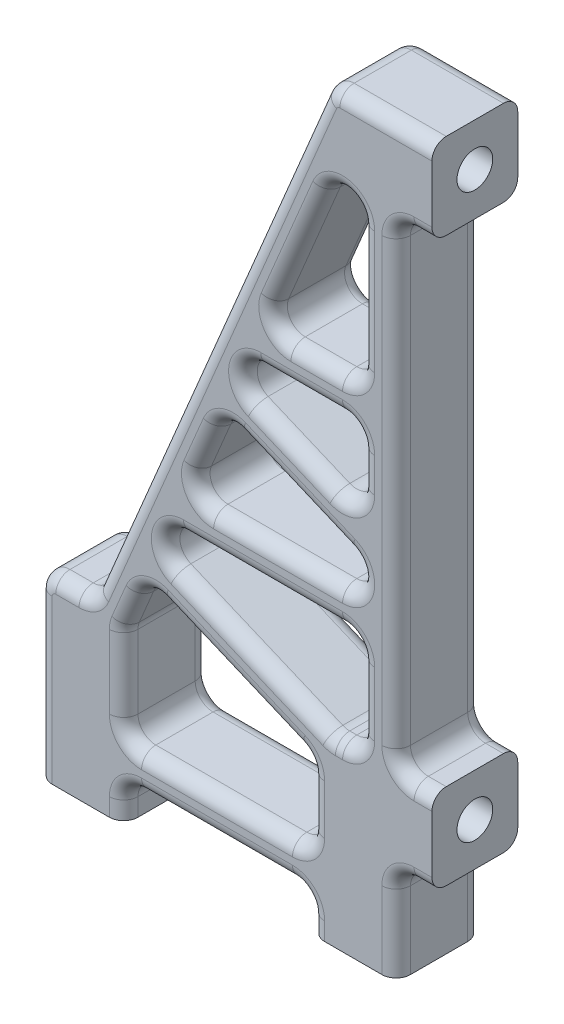
from build123d import *

# Parameters (mm, degrees)
EXTRUDE_1_DEPTH     = 6
EXTRUDE_2_DEPTH     = 6
FILLET_1_R          = 1.25
SKETCH_3_R          = 1.25
CUT_EXTRUDE_1_DEPTH = 7
SKETCH_4_R          = 1.25
CUT_EXTRUDE_2_DEPTH = 7
FILLET_7_R          = 1


with BuildPart() as part:
    # Эскиз1 → Бобышка-Вытянуть1 (new body)
    with BuildSketch(Plane.XY):
        with BuildLine():
            Line((27.55, 46), (27.55, 52))
            Line((27.55, 52), (21.113666967, 52))
            ThreePointArc((21.113666967, 52), (20.422226359, 51.79135003), (19.96161625, 51.235055816))
            Line((19.96161625, 51.235055816), (4.029534487, 13.394944184))
            ThreePointArc((4.029534487, 13.394944184), (3.568924378, 12.83864997), (2.877483769, 12.63))
            Line((2.877483769, 12.63), (1.25, 12.63))
            ThreePointArc((1.25, 12.63), (0.366116524, 12.263883476), (0, 11.38))
            Line((0, 11.38), (0, 0))
            Line((0, 0), (6, 0))
            Line((6, 0), (6, 1.25))
            ThreePointArc((6, 1.25), (6.366116524, 2.133883476), (7.25, 2.5))
            Line((7.25, 2.5), (17.8, 2.5))
            ThreePointArc((17.8, 2.5), (18.683883476, 2.133883476), (19.05, 1.25))
            Line((19.05, 1.25), (19.05, 0))
            Line((19.05, 0), (25.05, 0))
            Line((25.05, 0), (25.05, 5.38))
            ThreePointArc((25.05, 5.38), (25.416116524, 6.263883476), (26.3, 6.63))
            Line((26.3, 6.63), (27.55, 6.63))
            Line((27.55, 6.63), (27.55, 12.63))
            Line((27.55, 12.63), (26.3, 12.63))
            ThreePointArc((26.3, 12.63), (25.416116524, 12.996116524), (25.05, 13.88))
            Line((25.05, 13.88), (25.05, 44.75))
            ThreePointArc((25.05, 44.75), (25.416116524, 45.633883476), (26.3, 46))
            Line((26.3, 46), (27.55, 46))
        make_face()
        with BuildLine():
            Line((19.05, 6.25), (19.05, 11.38))
            ThreePointArc((19.05, 11.38), (19.416116524, 12.263883476), (20.3, 12.63))
            Line((20.3, 12.63), (21.3, 12.63))
            ThreePointArc((21.3, 12.63), (22.183883476, 12.996116524), (22.55, 13.88))
            Line((22.55, 13.88), (22.55, 44.75))
            ThreePointArc((22.55, 44.75), (21.547423325, 45.975268011), (20.147949283, 45.235055816))
            Line((20.147949283, 45.235055816), (6.097949283, 11.865055816))
            ThreePointArc((6.097949283, 11.865055816), (6.024731989, 11.627423325), (6, 11.38))
            Line((6, 11.38), (6, 6.25))
            ThreePointArc((6, 6.25), (6.366116524, 5.366116524), (7.25, 5))
            Line((7.25, 5), (17.8, 5))
            ThreePointArc((17.8, 5), (18.683883476, 5.366116524), (19.05, 6.25))
        make_face(mode=Mode.SUBTRACT)
    extrude(amount=EXTRUDE_1_DEPTH)

    # Эскиз2 → Бобышка-Вытянуть2 (add)
    with BuildSketch(Plane.XY):
        with BuildLine():
            Line((9.033112254, 18.836329009), (7.577944882, 15.380177038))
            Line((7.577944882, 15.380177038), (19.05, 10.55001898))
            Line((19.05, 10.55001898), (19.05, 11.38))
            ThreePointArc((19.05, 11.38), (19.416116524, 12.263883476), (20.3, 12.63))
            Line((20.3, 12.63), (20.552417555, 12.63))
            Line((20.552417555, 12.63), (9.700107232, 17.199222656))
            ThreePointArc((9.700107232, 17.199222656), (9.027553953, 17.879636665), (9.033112254, 18.836329009))
        make_face()
        with BuildLine():
            Line((15.809843094, 34.931667665), (14.435181166, 31.666723286))
            ThreePointArc((14.435181166, 31.666723286), (14.895791269, 32.223017637), (15.587231966, 32.431667665))
            Line((15.587231966, 32.431667665), (22.55, 32.431667665))
            Line((22.55, 32.431667665), (22.55, 34.931667665))
            Line((22.55, 34.931667665), (15.809843094, 34.931667665))
        make_face()
        with BuildLine():
            ThreePointArc((21.785055816, 24.503324091), (22.34135003, 24.042713982), (22.55, 23.351273374))
            Line((22.55, 23.351273374), (22.55, 26.893808584))
            Line((22.55, 26.893808584), (15.10217615, 30.029616948))
            ThreePointArc((15.10217615, 30.029616948), (14.429622874, 30.710030949), (14.435181166, 31.666723286))
            Line((14.435181166, 31.666723286), (12.9800138, 28.210571329))
            Line((12.9800138, 28.210571329), (21.785055816, 24.503324091))
        make_face()
        with BuildLine():
            Line((10.407774176, 22.101273374), (9.033112254, 18.836329009))
            ThreePointArc((9.033112254, 18.836329009), (9.493722358, 19.39262335), (10.185163048, 19.601273374))
            Line((10.185163048, 19.601273374), (22.55, 19.601273374))
            Line((22.55, 19.601273374), (22.55, 23.351273374))
            ThreePointArc((22.55, 23.351273374), (22.183883476, 22.467389897), (21.3, 22.101273374))
            Line((21.3, 22.101273374), (10.407774176, 22.101273374))
        make_face()
    extrude(amount=EXTRUDE_2_DEPTH)

    # Скругление1
    fillet_1_edges = [part.edges().sort_by_distance(p)[0] for p in [
        (19.05, 10.55001898, 3),
        (20.552417555, 12.63, 3),
        (7.577944882, 15.380177038, 3),
        (22.55, 19.601273374, 3),
        (10.407774176, 22.101273374, 3),
        (12.9800138, 28.210571329, 3),
        (22.55, 26.893808584, 3),
        (22.55, 32.431667665, 3),
        (15.809843094, 34.931667665, 3),
        (22.55, 34.931667665, 3),
    ]]
    fillet(fillet_1_edges, radius=FILLET_1_R)

    # Эскиз3 → Вырез-Вытянуть1 (cut)
    with BuildSketch(Plane(origin=(27.55, 0, 0), x_dir=(0, 0, -1), z_dir=(1, 0, 0))):
        with Locations((-3, 49)):
            Circle(SKETCH_3_R)
        with Locations((-3, 9.63)):
            Circle(SKETCH_3_R)
    extrude(amount=-CUT_EXTRUDE_1_DEPTH, mode=Mode.SUBTRACT)

    # Эскиз4 → Вырез-Вытянуть2 (cut)
    with BuildSketch(Plane.XZ):
        with Locations((3, 3)):
            Circle(SKETCH_4_R)
        with Locations((22.05, 3)):
            Circle(SKETCH_4_R)
    extrude(amount=-CUT_EXTRUDE_2_DEPTH, mode=Mode.SUBTRACT)

    # Скругление7
    fillet_7_edges = [part.edges().sort_by_distance(p)[0] for p in [
        (21.547423325, 45.975268011, 6),
        (14.361963955, 31.42909099, 6),
        (18.443615983, 32.431667665, 6),
        (17.958560167, 26.114419802, 6),
        (22.525268011, 23.103850049, 6),
        (15.009943263, 14.96358597, 6),
        (8.959895037, 18.598696699, 6),
        (15.742581524, 19.601273374, 6),
        (6, 0.625, 6),
        (24.331833484, 52, 6),
        (20.422226359, 51.79135003, 6),
        (0, 5.69, 6),
        (19.496208131, 34.931667665, 6),
        (17.958560167, 28.826973992, 6),
        (16.795173672, 22.101273374, 6),
        (25.05, 29.315, 6),
        (25.05, 2.69, 6),
        (12.525, 2.5, 6),
        (11.995575368, 32.315, 6),
        (16.651066233, 35.490227057, 6),
        (18.344157414, 40.950889648, 6),
        (22.55, 40.465833832, 6),
        (22.183883476, 35.297784189, 6),
        (22.183883476, 32.065551141, 6),
        (22.55, 29.979024709, 6),
        (21.991440608, 27.735031723, 6),
        (11.248997315, 22.659832765, 6),
        (11.816627306, 25.447424901, 6),
        (13.175372084, 27.731073927, 6),
        (16.651066233, 35.490227057, 0),
        (18.344157414, 40.950889648, 0),
        (21.547423325, 45.975268011, 0),
        (22.55, 40.465833832, 0),
        (22.183883476, 35.297784189, 0),
        (14.361963955, 31.42909099, 0),
        (18.443615983, 32.431667665, 0),
        (22.183883476, 32.065551141, 0),
        (22.55, 29.979024709, 0),
        (21.991440608, 27.735031723, 0),
        (11.248997315, 22.659832765, 0),
        (11.816627306, 25.447424901, 0),
        (13.175372084, 27.731073927, 0),
        (17.958560167, 26.114419802, 0),
        (22.525268011, 23.103850049, 0),
        (20.557411786, 12.654731989, 0),
        (21.052417555, 12.63, 0),
        (22.183883476, 12.996116524, 0),
        (22.55, 16.115636687, 0),
        (22.183883476, 19.23515685, 0),
        (15.742581524, 19.601273374, 0),
        (8.959895037, 18.598696699, 0),
        (6.366116524, 5.366116524, 0),
        (6, 8.815, 0),
        (6.024731989, 11.627423325, 0),
        (6.595419175, 13.046591068, 0),
        (7.773303166, 14.900679636, 0),
        (13.507525708, 12.883604949, 0),
        (18.84135003, 10.411478568, 0),
        (19.05, 7.98501898, 0),
        (18.683883476, 5.366116524, 0),
        (24.331833484, 52, 0),
        (20.422226359, 51.79135003, 0),
        (0, 5.69, 0),
        (6, 0.625, 0),
        (20.557411786, 12.654731989, 6),
        (21.052417555, 12.63, 6),
        (22.183883476, 12.996116524, 6),
        (22.55, 16.115636687, 6),
        (22.183883476, 19.23515685, 6),
        (18.683883476, 5.366116524, 6),
        (12.525, 5, 6),
        (6.366116524, 5.366116524, 6),
        (6, 8.815, 6),
        (6.024731989, 11.627423325, 6),
        (6.595419175, 13.046591068, 6),
        (7.773303166, 14.900679636, 6),
        (13.507525708, 12.883604949, 6),
        (18.84135003, 10.411478568, 6),
        (19.496208131, 34.931667665, 0),
        (17.958560167, 28.826973992, 0),
        (16.795173672, 22.101273374, 0),
        (15.009943263, 14.96358597, 0),
        (12.525, 5, 0),
        (11.995575368, 32.315, 0),
        (12.525, 2.5, 0),
        (25.05, 2.69, 0),
        (25.05, 29.315, 0),
        (19.05, 7.98501898, 6),
        (0.366116524, 12.263883476, 0),
        (2.063741885, 12.63, 0),
        (3.568924378, 12.83864997, 0),
        (6.366116524, 2.133883476, 0),
        (19.05, 0.625, 0),
        (18.683883476, 2.133883476, 0),
        (26.925, 6.63, 0),
        (25.416116524, 6.263883476, 0),
        (26.925, 12.63, 0),
        (25.416116524, 12.996116524, 0),
        (26.925, 46, 0),
        (25.416116524, 45.633883476, 0),
        (26.925, 12.63, 6),
        (25.416116524, 12.996116524, 6),
        (26.925, 46, 6),
        (25.416116524, 45.633883476, 6),
        (26.925, 6.63, 6),
        (25.416116524, 6.263883476, 6),
        (0.366116524, 12.263883476, 6),
        (2.063741885, 12.63, 6),
        (3.568924378, 12.83864997, 6),
        (6.366116524, 2.133883476, 6),
        (19.05, 0.625, 6),
        (18.683883476, 2.133883476, 6),
    ]]
    fillet(fillet_7_edges, radius=FILLET_7_R)


solid = part.part
